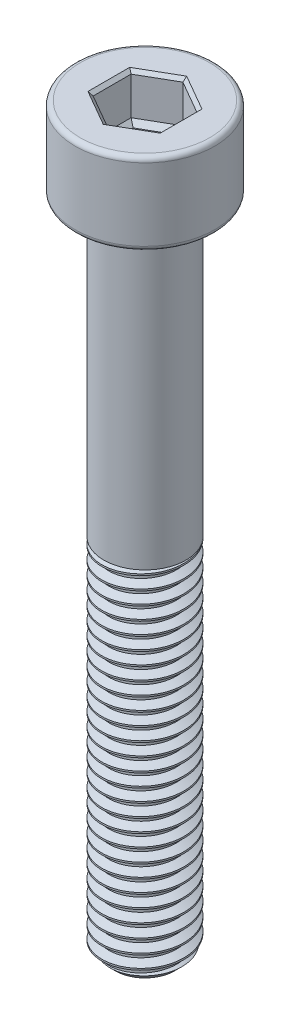
from build123d import *

# Parameters (mm, degrees)
SKETCH1_R           = 2.5
BOSS_EXTRUDE1_DEPTH = 22
THREAD1_PITCH       = 0.8
SKETCH2_R           = 2.5
BOSS_EXTRUDE2_DEPTH = 18
SKETCH3_R           = 4.25
BOSS_EXTRUDE3_DEPTH = 5
FILLET1_R           = 0.3
CUT_EXTRUDE1_DEPTH  = 2.5
CHAMFER1_SIZE       = 0.2
CUT_EXTRUDE2_DEPTH  = 0.3
CUT_EXTRUDE2_DRAFT  = -45


with BuildPart() as part:
    # Sketch1 → Boss-Extrude1 (new body)
    with BuildSketch(Plane(origin=(0, 0, 0), x_dir=(1, 0, 0), z_dir=(0, 1, 0))):
        with Locations(Location((0, 0, 0), (0, 0, 270))):
            Circle(SKETCH1_R)
    extrude(amount=BOSS_EXTRUDE1_DEPTH)

    # Thread1: the profile of Thread Profile1 profile screwed along a right-hand helix of 28.75 turns, 8 arcs to a turn; built about Z, then put on its axis
    thread1_z = Axis((0, 0, 0), (0, 0, 1))
    thread1_corners = [(2.5003, 0, -0.000173205), (2.5003, 0, 0.700173203), (2.0669873, 0, 0.449999999), (2.0669873, 0, 0.249999999)]
    with BuildLine(mode=Mode.PRIVATE) as thread1_profile:
        Line(thread1_corners[0], thread1_corners[1])
        Line(thread1_corners[1], thread1_corners[2])
        Line(thread1_corners[2], thread1_corners[3])
        Line(thread1_corners[3], thread1_corners[0])
    thread1_cap = Face(thread1_profile.wire())
    thread1_turn_angles = [0, 22.5, 45, 67.5, 90, 112.5, 135, 157.5, 180, 202.5, 225, 247.5, 270, 292.5, 315, 337.5, 360]
    thread1_turn_weights = [1, 0.9238795325112867, 1, 0.9238795325112867, 1, 0.9238795325112867, 1, 0.9238795325112867, 1, 0.9238795325112867, 1, 0.9238795325112867, 1, 0.9238795325112867, 1, 0.9238795325112867, 1]
    thread1_turn_rails = [Edge.make_bspline([Vector(p[0], p[1], 0).rotate(thread1_z, thread1_turn_angles[k]) / thread1_turn_weights[k] + Vector(0, 0, p[2] + THREAD1_PITCH * thread1_turn_angles[k] / 360) for k in range(17)], [0, 0, 0, 1, 1, 2, 2, 3, 3, 4, 4, 5, 5, 6, 6, 7, 7, 8, 8, 8], 2, thread1_turn_weights) for p in thread1_corners]
    thread1_turn_sides = [Face.make_surface_from_curves(thread1_turn_rails[p[0]], thread1_turn_rails[p[1]]) for p in [(0, 1), (1, 2), (2, 3), (3, 0)]]
    thread1_last_angles = [10080, 10102.5, 10125, 10147.5, 10170, 10192.5, 10215, 10237.5, 10260, 10282.5, 10305, 10327.5, 10350]
    thread1_last_weights = [1, 0.9238795325112867, 1, 0.9238795325112867, 1, 0.9238795325112867, 1, 0.9238795325112867, 1, 0.9238795325112867, 1, 0.9238795325112867, 1]
    thread1_last_rails = [Edge.make_bspline([Vector(p[0], p[1], 0).rotate(thread1_z, thread1_last_angles[k]) / thread1_last_weights[k] + Vector(0, 0, p[2] + THREAD1_PITCH * thread1_last_angles[k] / 360) for k in range(13)], [0, 0, 0, 1, 1, 2, 2, 3, 3, 4, 4, 5, 5, 6, 6, 6], 2, thread1_last_weights) for p in thread1_corners]
    thread1_last_sides = [Face.make_surface_from_curves(thread1_last_rails[p[0]], thread1_last_rails[p[1]]) for p in [(0, 1), (1, 2), (2, 3), (3, 0)]]
    thread1 = Plane(origin=(0, 23, 0), x_dir=(-1, 0, 0), z_dir=(0, -1, 0)) * Solid(Shell([*[p.moved(Location((0, 0, THREAD1_PITCH * i))) for i in range(28) for p in thread1_turn_sides], *thread1_last_sides, thread1_cap, thread1_cap.rotate(thread1_z, 10350).moved(Location((0, 0, THREAD1_PITCH * 10350 / 360)))]))
    add(thread1, mode=Mode.SUBTRACT)

    # Sketch2 → Boss-Extrude2 (add)
    with BuildSketch(Plane(origin=(0, 22, 0), x_dir=(1, 0, 0), z_dir=(0, 1, 0))):
        with Locations(Location((0, 0, 0), (0, 0, 90))):
            Circle(SKETCH2_R)
    extrude(amount=BOSS_EXTRUDE2_DEPTH)

    # Sketch3 → Boss-Extrude3 (add)
    with BuildSketch(Plane(origin=(0, 40, 0), x_dir=(1, 0, 0), z_dir=(0, 1, 0))):
        with Locations(Location((0, 0, 0), (0, 0, 270))):
            Circle(SKETCH3_R)
    extrude(amount=BOSS_EXTRUDE3_DEPTH)

    # Fillet1
    fillet1_edges = [part.edges().sort_by_distance(p)[0] for p in [
        (0, 40, -4.25),
        (0, 45, -4.25),
    ]]
    fillet(fillet1_edges, radius=FILLET1_R)

    # Sketch4 → Cut-Revolve1 (revolve, cut)
    with BuildSketch(Plane.XY, mode=Mode.PRIVATE) as cut_revolve1_sk:
        Polygon((2.51, 0), (2.51, 0.7), (1.81, 0), align=None)
    revolve(cut_revolve1_sk.sketch.rotate(Axis((0, 0, 0), (0, 1, 0)), 90), axis=Axis((0, 0, 0), (0, 1, 0)), mode=Mode.SUBTRACT)

    # Sketch5 → Cut-Extrude1 (cut)
    with BuildSketch(Plane(origin=(0, 45, 0), x_dir=(1, 0, 0), z_dir=(0, 1, 0))):
        Polygon((0, 2.309401077), (-2, 1.154700538), (-2, -1.154700538), (0, -2.309401077), (2, -1.154700538), (2, 1.154700538), align=None)
    extrude(amount=-CUT_EXTRUDE1_DEPTH, mode=Mode.SUBTRACT)

    # Chamfer1
    chamfer1_edges = [part.edges().sort_by_distance(p)[0] for p in [
        (1, 45, -1.732050808),
        (-1, 45, -1.732050808),
        (-2, 45, 0),
        (-1, 45, 1.732050808),
        (1, 45, 1.732050808),
        (2, 45, 0),
    ]]
    chamfer(chamfer1_edges, length=CHAMFER1_SIZE)


with BuildPart() as cut_extrude2_tool:
    # Sketch6 → Cut-Extrude2 (with draft: the straight prism first)
    with BuildSketch(Plane(origin=(0, 42.5, 0), x_dir=(1, 0, 0), z_dir=(0, 1, 0))):
        Polygon((0, 2.309401077), (-2, 1.154700538), (-2, -1.154700538), (0, -2.309401077), (2, -1.154700538), (2, 1.154700538), align=None)
    extrude(amount=-CUT_EXTRUDE2_DEPTH)
    # Cut-Extrude2: the draft: its side faces are tilted about the plane it starts from
    cut_extrude2_sides = [cut_extrude2_tool.faces().sort_by_distance(p)[0] for p in [
        (-1, 42.35, -1.732050808),
        (-2, 42.35, 0),
        (-1, 42.35, 1.732050808),
        (1, 42.35, 1.732050808),
        (2, 42.35, 0),
        (1, 42.35, -1.732050808),
    ]]
    draft(cut_extrude2_sides, Plane(origin=(0, 42.5, 0), x_dir=(1, 0, 0), z_dir=(0, 1, 0)), CUT_EXTRUDE2_DRAFT)


with BuildPart() as part_1:
    add(part.part)

    # Cut-Extrude2: cut by cut_extrude2_tool
    add(cut_extrude2_tool.part, mode=Mode.SUBTRACT)


solid = part_1.part
